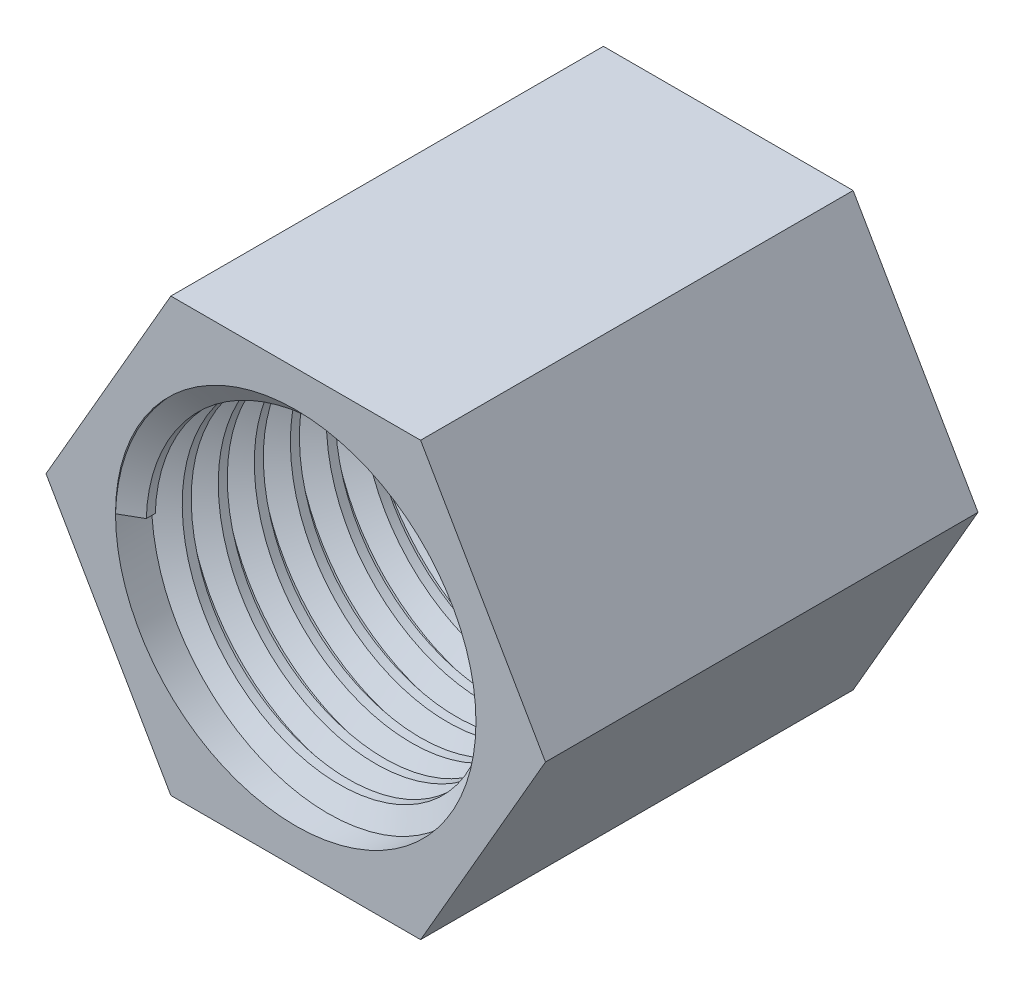
from build123d import *
from build123d.topology import SkipClean

# Parameters (mm, degrees)
BOSS_EXTRUDE1_DEPTH = 12
SKETCH2_R           = 5
CUT_EXTRUDE1_DEPTH  = 10
THREAD1_PITCH       = 1
SKETCH3_R           = 3.5
CUT_EXTRUDE2_DEPTH  = 16.099806685


with BuildPart() as part:
    # Sketch1 → Boss-Extrude1 (new body)
    with BuildSketch(Plane.XY):
        Polygon((6.92820323, 0), (3.464101615, 6), (-3.464101615, 6), (-6.92820323, 0), (-3.464101615, -6), (3.464101615, -6), align=None)
    extrude(amount=BOSS_EXTRUDE1_DEPTH)

    # Sketch2 → Cut-Extrude1 (cut)
    with BuildSketch(Plane.XY.offset(12)):
        Circle(SKETCH2_R)
    extrude(amount=-CUT_EXTRUDE1_DEPTH, mode=Mode.SUBTRACT)

    # Thread1: the profile of Thread Profile1 profile screwed along a right-hand helix of 10 turns, 8 arcs to a turn; built about Z, then put on its axis
    with SkipClean():  # the faces are left unmerged after this step: merging them gives an invalid solid
        thread1_z = Axis((0, 0, 0), (0, 0, 1))
        thread1_corners = [(5.0003, 0, -0.000173205), (5.0003, 0, 0.875173202), (4.458734125, 0, 0.562499999), (4.458734125, 0, 0.312499999)]
        with BuildLine(mode=Mode.PRIVATE) as thread1_profile:
            Line(thread1_corners[0], thread1_corners[1])
            Line(thread1_corners[1], thread1_corners[2])
            Line(thread1_corners[2], thread1_corners[3])
            Line(thread1_corners[3], thread1_corners[0])
        thread1_cap = Face(thread1_profile.wire())
        thread1_turn_angles = [0, 22.5, 45, 67.5, 90, 112.5, 135, 157.5, 180, 202.5, 225, 247.5, 270, 292.5, 315, 337.5, 360]
        thread1_turn_weights = [1, 0.9238795325112867, 1, 0.9238795325112867, 1, 0.9238795325112867, 1, 0.9238795325112867, 1, 0.9238795325112867, 1, 0.9238795325112867, 1, 0.9238795325112867, 1, 0.9238795325112867, 1]
        thread1_turn_rails = [Edge.make_bspline([Vector(p[0], p[1], 0).rotate(thread1_z, thread1_turn_angles[k]) / thread1_turn_weights[k] + Vector(0, 0, p[2] + THREAD1_PITCH * thread1_turn_angles[k] / 360) for k in range(17)], [0, 0, 0, 1, 1, 2, 2, 3, 3, 4, 4, 5, 5, 6, 6, 7, 7, 8, 8, 8], 2, thread1_turn_weights) for p in thread1_corners]
        thread1_turn_sides = [Face.make_surface_from_curves(thread1_turn_rails[p[0]], thread1_turn_rails[p[1]]) for p in [(0, 1), (1, 2), (2, 3), (3, 0)]]
        thread1 = Plane(origin=(0, 0, 12), x_dir=(-1, 0, 0), z_dir=(0, 0, -1)) * Solid(Shell([*[p.moved(Location((0, 0, THREAD1_PITCH * i))) for i in range(10) for p in thread1_turn_sides], thread1_cap, thread1_cap.rotate(thread1_z, 3600).moved(Location((0, 0, THREAD1_PITCH * 3600 / 360)))]))
        add(thread1)

    # Sketch3 → Cut-Extrude2 (cut, through all)
    with SkipClean():  # the faces are left unmerged after this step: merging them gives an invalid solid
        with BuildSketch(Plane(origin=(0, 0, 0), x_dir=(-1, 0, 0), z_dir=(0, 0, -1))):
            Circle(SKETCH3_R)
        extrude(amount=-CUT_EXTRUDE2_DEPTH, mode=Mode.SUBTRACT)


solid = part.part
